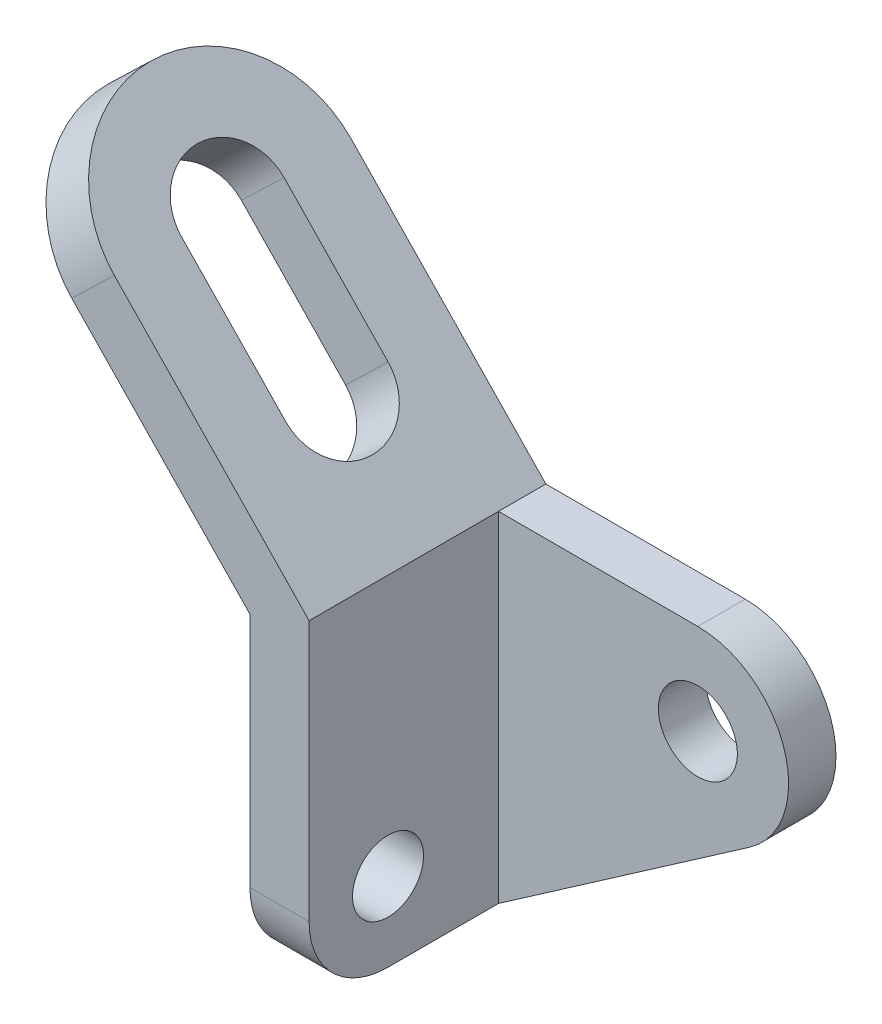
from build123d import *

# Parameters (mm, degrees)
EXTRUDE_1_DEPTH     = 60
FILLET_1_R          = 30
CUT_EXTRUDE_1_DEPTH = 147.1512713
SKETCH_4_R          = 10
EXTRUDE_3_DEPTH     = 12
FILLET_2_R          = 20
SKETCH_5_R          = 9
CUT_EXTRUDE_3_DEPTH = 15


with BuildPart() as part:
    # 스케치1 → 보스-돌출1 (new body)
    with BuildSketch(Plane.XY):
        Polygon((-22.843222842, 40.291179042), (43.149322352, -28.04610199), (43.149322352, -108.04610199), (58.149322352, -108.04610199), (58.149322352, -21.985708603), (-12.053125837, 50.711054599), align=None)
    extrude(amount=EXTRUDE_1_DEPTH)

    # 필렛1
    fillet_1_edges = [part.edges().sort_by_distance(p)[0] for p in [
        (-17.448174339, 45.50111682, 0),
        (-17.448174339, 45.50111682, 60),
    ]]
    fillet(fillet_1_edges, radius=FILLET_1_R - 0.0001)  # a hair under: the kernel refuses the full size

    # 스케치2 → 컷-돌출1 (cut, through all)
    with BuildSketch(Plane(origin=(19.103194466, 18.447740459, 0), x_dir=(0, 0, -1), z_dir=(0.7193398003386495, 0.694658370458999, 0))):
        with BuildLine():
            Line((-17, 14.851284643), (-17, -23.148715357))
            ThreePointArc((-17, -23.148715357), (-30, -36.148715357), (-43, -23.148715357))
            Line((-43, -23.148715357), (-43, 14.851284643))
            ThreePointArc((-43, 14.851284643), (-30, 27.851284643), (-17, 14.851284643))
        make_face()
    extrude(amount=-CUT_EXTRUDE_1_DEPTH, mode=Mode.SUBTRACT)

    # 스케치4 → 보스-돌출3 (add)
    with BuildSketch(Plane(origin=(0, 0, 0), x_dir=(-1, 0, 0), z_dir=(0, 0, -1))):
        with BuildLine():
            ThreePointArc((-121.787629996, -63.881157116), (-130.624090494, -38.115312537), (-108.674200792, -21.985708603))
            Line((-108.674200792, -21.985708603), (-58.149322352, -21.985708603))
            Line((-58.149322352, -21.985708603), (-58.149322352, -108.04610199))
            Line((-58.149322352, -108.04610199), (-121.787629996, -63.881157116))
        make_face()
        with Locations((-108.674200792, -44.985708603)):
            Circle(SKETCH_4_R, mode=Mode.SUBTRACT)
    extrude(amount=-EXTRUDE_3_DEPTH)

    # 필렛2
    fillet_2_edges = [part.edges().sort_by_distance(p)[0] for p in [
        (50.649322352, -108.04610199, 60),
    ]]
    fillet(fillet_2_edges, radius=FILLET_2_R)

    # 스케치5 → 컷-돌출3 (cut)
    with BuildSketch(Plane(origin=(58.149322352, 0, 0), x_dir=(0, 0, -1), z_dir=(1, 0, 0))):
        with Locations(Location((-40, -88.04610199, 0), (0, 0, 90))):
            Circle(SKETCH_5_R)
    extrude(amount=-CUT_EXTRUDE_3_DEPTH, mode=Mode.SUBTRACT)


solid = part.part
